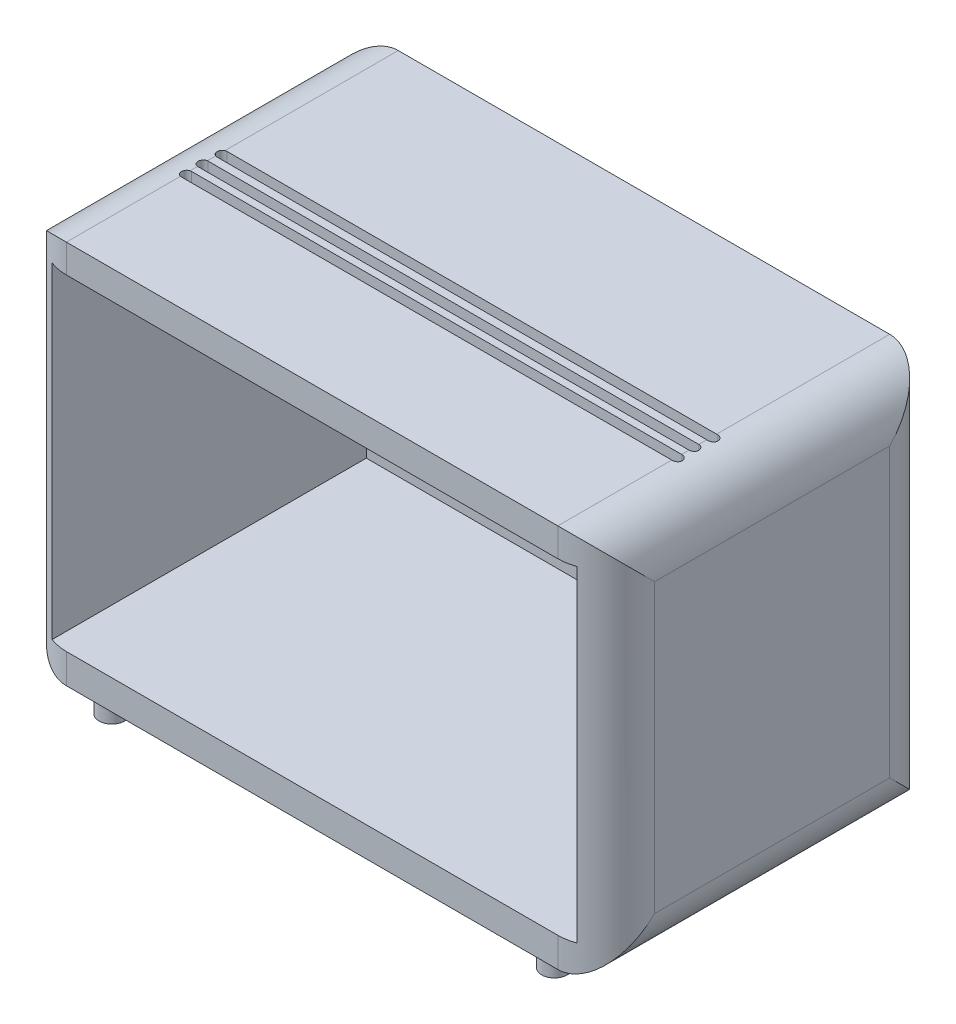
from build123d import *

# Parameters (mm, degrees)
IZIM1_W                     = 121.550964813
IZIM1_H                     = 79.400227015
IZIM1_W_2                   = 108.562656073
IZIM1_H_2                   = 67.392167991
Y_KSEKLIK_EKSTR_ZYON1_DEPTH = 68.58
IZIM2_W                     = 108.665778405
IZIM2_H                     = 2.839609685
Y_KSEKLIK_EKSTR_ZYON3_DEPTH = 67.31
IZIM4_W                     = 43.769026383
IZIM4_H                     = 34.779664875
KES_EKSTR_ZYON3_DEPTH       = 51.308
RADYUS1_R                   = 10
RADYUS2_R                   = 10
KES_EKSTR_ZYON6_DEPTH       = 25.4
Y_KSEKLIK_EKSTR_ZYON4_DEPTH = 4.572


with BuildPart() as part:
    # Çizim1 → Yükseklik-Ekstrüzyon1 (new body)
    with BuildSketch(Plane.XY):
        with Locations((3.983010787, 3.063280364)):
            Rectangle(IZIM1_W, IZIM1_H)
        with Locations((3.860479571, 3.185811577)):
            Rectangle(IZIM1_W_2, IZIM1_H_2, mode=Mode.SUBTRACT)
    extrude(amount=Y_KSEKLIK_EKSTR_ZYON1_DEPTH)

    # Çizim2 → Yükseklik-Ekstrüzyon3 (add)
    with BuildSketch(Plane(origin=(0, -30.510272418, 0), x_dir=(1, 0, 0), z_dir=(0, 1, 0))):
        with Locations((3.70835341, -1.557090266)):
            Rectangle(IZIM2_W, IZIM2_H)
    extrude(amount=Y_KSEKLIK_EKSTR_ZYON3_DEPTH)

    # Çizim4 → Kes-Ekstrüzyon3 (cut)
    with BuildSketch(Plane(origin=(0, 0, 0.137285424), x_dir=(-1, 0, 0), z_dir=(0, 0, -1))):
        with Locations((-2.08713858, 8.765719608)):
            Rectangle(IZIM4_W, IZIM4_H)
    extrude(amount=-KES_EKSTR_ZYON3_DEPTH, mode=Mode.SUBTRACT)

    # Radyus1
    # the kernel refuses this fillet: 10 mm, written as the material it takes off along each edge
    with BuildSketch(Plane(origin=(64.758493193, -36.636833144, -25), x_dir=(0, 1, 0), z_dir=(0, 0, 1)), Plane(origin=(64.758493193, 42.763393871, -25), x_dir=(-1, 0, 0), z_dir=(0, 0, 1))) as radyus1_piece_1:
        with BuildLine():
            CenterArc((RADYUS1_R, RADYUS1_R), RADYUS1_R, 180, 90)
            Line((0, RADYUS1_R), (0, 0))
            Line((0, 0), (RADYUS1_R, 0))
        make_face()
    extrude(amount=118.58, mode=Mode.SUBTRACT)
    with BuildSketch(Plane(origin=(64.758493193, 67.763393871, 68.58), x_dir=(0, 0, -1), z_dir=(0, -1, 0))) as radyus1_piece_2:
        with BuildLine():
            CenterArc((RADYUS1_R, -RADYUS1_R), RADYUS1_R, 90, 90)
            Line((0, -RADYUS1_R), (0, 0))
            Line((0, 0), (RADYUS1_R, 0))
        make_face()
    extrude(amount=129.400227015, mode=Mode.SUBTRACT)
    with BuildSketch(Plane(origin=(64.758493193, 67.763393871, 0), x_dir=(0, 0, 1), z_dir=(0, -1, 0))) as radyus1_piece_3:
        with BuildLine():
            CenterArc((RADYUS1_R, RADYUS1_R), RADYUS1_R, 180, 90)
            Line((0, RADYUS1_R), (0, 0))
            Line((0, 0), (RADYUS1_R, 0))
        make_face()
    extrude(amount=129.400227015, mode=Mode.SUBTRACT)

    # Radyus2
    # the kernel refuses this fillet: 10 mm, written as the material it takes off along each edge
    with BuildSketch(Plane(origin=(-56.79247162, 42.763393871, -25), x_dir=(1, 0, 0), z_dir=(0, 0, 1)), Plane(origin=(-56.79247162, -36.636833144, -25), x_dir=(0, 1, 0), z_dir=(0, 0, 1))) as radyus2_piece_1:
        with BuildLine():
            CenterArc((RADYUS2_R, -RADYUS2_R), RADYUS2_R, 90, 90)
            Line((0, -RADYUS2_R), (0, 0))
            Line((0, 0), (RADYUS2_R, 0))
        make_face()
    extrude(amount=118.58, mode=Mode.SUBTRACT)
    with BuildSketch(Plane(origin=(-56.79247162, -61.636833144, 68.58), x_dir=(1, 0, 0), z_dir=(0, 1, 0))) as radyus2_piece_2:
        with BuildLine():
            CenterArc((RADYUS2_R, RADYUS2_R), RADYUS2_R, 180, 90)
            Line((0, RADYUS2_R), (0, 0))
            Line((0, 0), (RADYUS2_R, 0))
        make_face()
    extrude(amount=129.400227015, mode=Mode.SUBTRACT)
    with BuildSketch(Plane(origin=(-56.79247162, -61.636833144, 0), x_dir=(1, 0, 0), z_dir=(0, 1, 0))) as radyus2_piece_3:
        with BuildLine():
            CenterArc((RADYUS2_R, -RADYUS2_R), RADYUS2_R, 90, 90)
            Line((0, -RADYUS2_R), (0, 0))
            Line((0, 0), (RADYUS2_R, 0))
        make_face()
    extrude(amount=129.400227015, mode=Mode.SUBTRACT)

    # Çizim5 → Kes-Ekstrüzyon6 (cut)
    with BuildSketch(Plane(origin=(0, 42.763393871, 0), x_dir=(1, 0, 0), z_dir=(0, 1, 0))):
        with BuildLine():
            Line((-46.423230595, -35.751971692), (55.012749139, -35.751971692))
            ThreePointArc((55.012749139, -35.751971692), (56.029772925, -36.768995478), (55.012749139, -37.786019263))
            Line((55.012749139, -37.786019263), (-46.423230595, -37.786019263))
            ThreePointArc((-46.423230595, -37.786019263), (-47.44025438, -36.768995478), (-46.423230595, -35.751971692))
        make_face()
        with BuildLine():
            Line((-46.550358568, -42.998266165), (54.885621166, -42.998266165))
            ThreePointArc((54.885621166, -42.998266165), (55.902644952, -44.015289951), (54.885621166, -45.032313737))
            Line((54.885621166, -45.032313737), (-46.550358568, -45.032313737))
            ThreePointArc((-46.550358568, -45.032313737), (-47.567382354, -44.015289951), (-46.550358568, -42.998266165))
        make_face()
        with BuildLine():
            Line((-46.677486541, -39.438682915), (54.758493193, -39.438682915))
            ThreePointArc((54.758493193, -39.438682915), (55.775516978, -40.455706701), (54.758493193, -41.472730487))
            Line((54.758493193, -41.472730487), (-46.677486541, -41.472730487))
            ThreePointArc((-46.677486541, -41.472730487), (-47.694510327, -40.455706701), (-46.677486541, -39.438682915))
        make_face()
    extrude(amount=-KES_EKSTR_ZYON6_DEPTH, mode=Mode.SUBTRACT)

    # Çizim6 → Yükseklik-Ekstrüzyon4 (add)
    with BuildSketch(Plane(origin=(0, -36.636833144, 0), x_dir=(-1, 0, 0), z_dir=(0, -1, 0))):
        with BuildLine():
            Line((-46.87100271, -4.227005014), (-46.87100271, -64.014742354))
            ThreePointArc((-46.87100271, -64.014742354), (-49.504404567, -66.64814421), (-52.137806423, -64.014742354))
            Line((-52.137806423, -64.014742354), (-52.137806423, -4.227005014))
            ThreePointArc((-52.137806423, -4.227005014), (-49.504404567, -1.593603158), (-46.87100271, -4.227005014))
        make_face()
        with BuildLine():
            Line((44.301980946, -4.525434052), (44.301980946, -64.313171393))
            ThreePointArc((44.301980946, -64.313171393), (41.66857909, -66.946573249), (39.035177234, -64.313171393))
            Line((39.035177234, -64.313171393), (39.035177234, -4.525434052))
            ThreePointArc((39.035177234, -4.525434052), (41.66857909, -1.892032196), (44.301980946, -4.525434052))
        make_face()
    extrude(amount=Y_KSEKLIK_EKSTR_ZYON4_DEPTH)


solid = part.part
